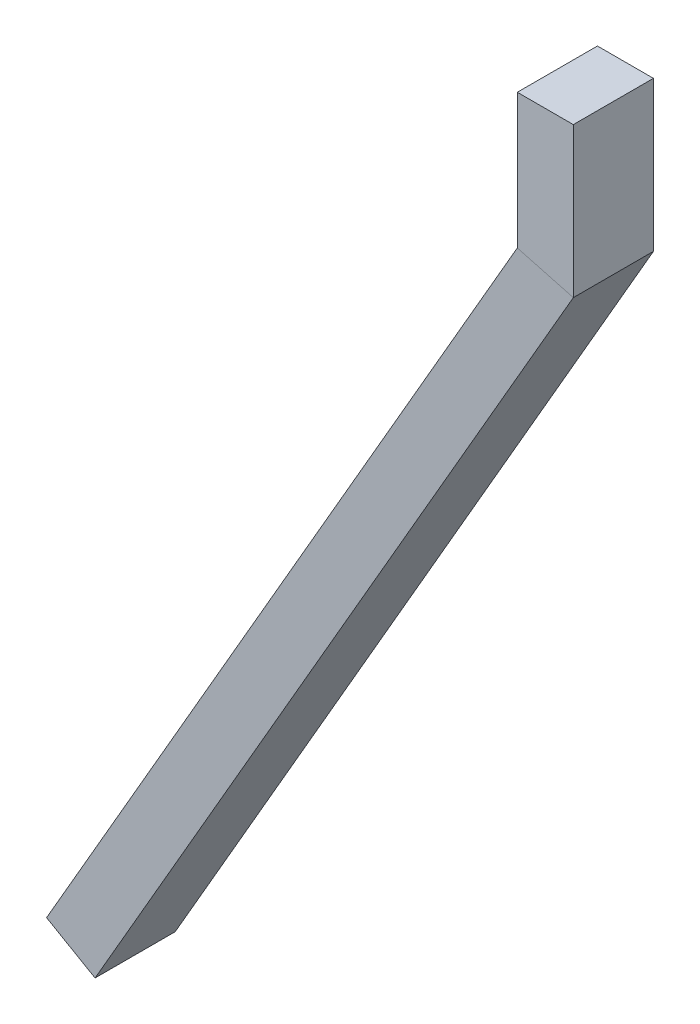
from build123d import *

# Parameters (mm, degrees)
ESQUISSE3_W = 1.180215402
ESQUISSE3_H = 1.688328332


with BuildPart() as part:
    # Balayage2: sweep along a path in Esquisse1
    with BuildLine(Plane.XY) as balayage2_path:
        Line((0, 0), (0, -3))
        Line((0, -3), (-10, -20.320508076))
    # Esquisse3 → Balayage2 (sweep)
    with BuildSketch(Plane(origin=(0, 0, 0), x_dir=(1, 0, 0), z_dir=(0, 1, 0))):
        with Locations((0, 0.844164166)):
            Rectangle(ESQUISSE3_W, ESQUISSE3_H)
    sweep(path=balayage2_path.line, transition=Transition.RIGHT)


solid = part.part
